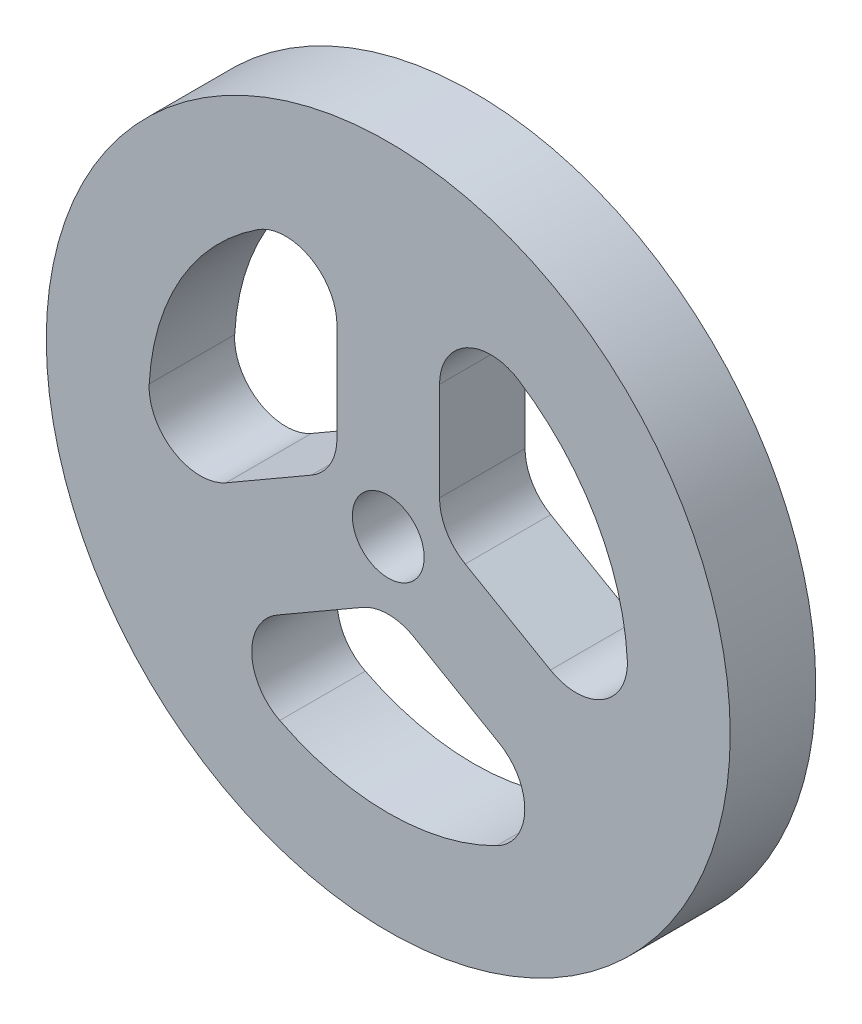
from build123d import *

# Parameters (mm, degrees)
SKETCH1_R           = 25.4
SKETCH1_R_2         = 2.667
BOSS_EXTRUDE3_DEPTH = 6.35
FILLET1_R           = 3.81


with BuildPart() as part:
    # Sketch1 → Boss-Extrude3 (new body)
    with BuildSketch(Plane.XY):
        Circle(SKETCH1_R)
        Circle(SKETCH1_R_2, mode=Mode.SUBTRACT)
        with BuildLine():
            Line((-13.135253489, -11.983051189), (0, -4.399409051))
            Line((0, -4.399409051), (13.135253489, -11.983051189))
            ThreePointArc((13.135253489, -11.983051189), (0, -17.78), (-13.135253489, -11.983051189))
        make_face(mode=Mode.SUBTRACT)
        with BuildLine():
            Line((-3.81, 17.366988801), (-3.81, 2.199704526))
            Line((-3.81, 2.199704526), (-16.945253489, -5.383937612))
            ThreePointArc((-16.945253489, -5.383937612), (-15.397931679, 8.89), (-3.81, 17.366988801))
        make_face(mode=Mode.SUBTRACT)
        with BuildLine():
            Line((16.945253489, -5.383937612), (3.81, 2.199704526))
            Line((3.81, 2.199704526), (3.81, 17.366988801))
            ThreePointArc((3.81, 17.366988801), (15.397931679, 8.89), (16.945253489, -5.383937612))
        make_face(mode=Mode.SUBTRACT)
    extrude(amount=BOSS_EXTRUDE3_DEPTH)

    # Fillet1
    fillet1_edges = [part.edges().sort_by_distance(p)[0] for p in [
        (0, -4.399409051, 3.175),
        (-13.135253489, -11.983051189, 3.175),
        (3.81, 17.366988801, 3.175),
        (3.81, 2.199704526, 3.175),
        (-16.945253489, -5.383937612, 3.175),
        (-3.81, 2.199704526, 3.175),
        (-3.81, 17.366988801, 3.175),
        (13.135253489, -11.983051189, 3.175),
        (16.945253489, -5.383937612, 3.175),
    ]]
    fillet(fillet1_edges, radius=FILLET1_R)


solid = part.part
